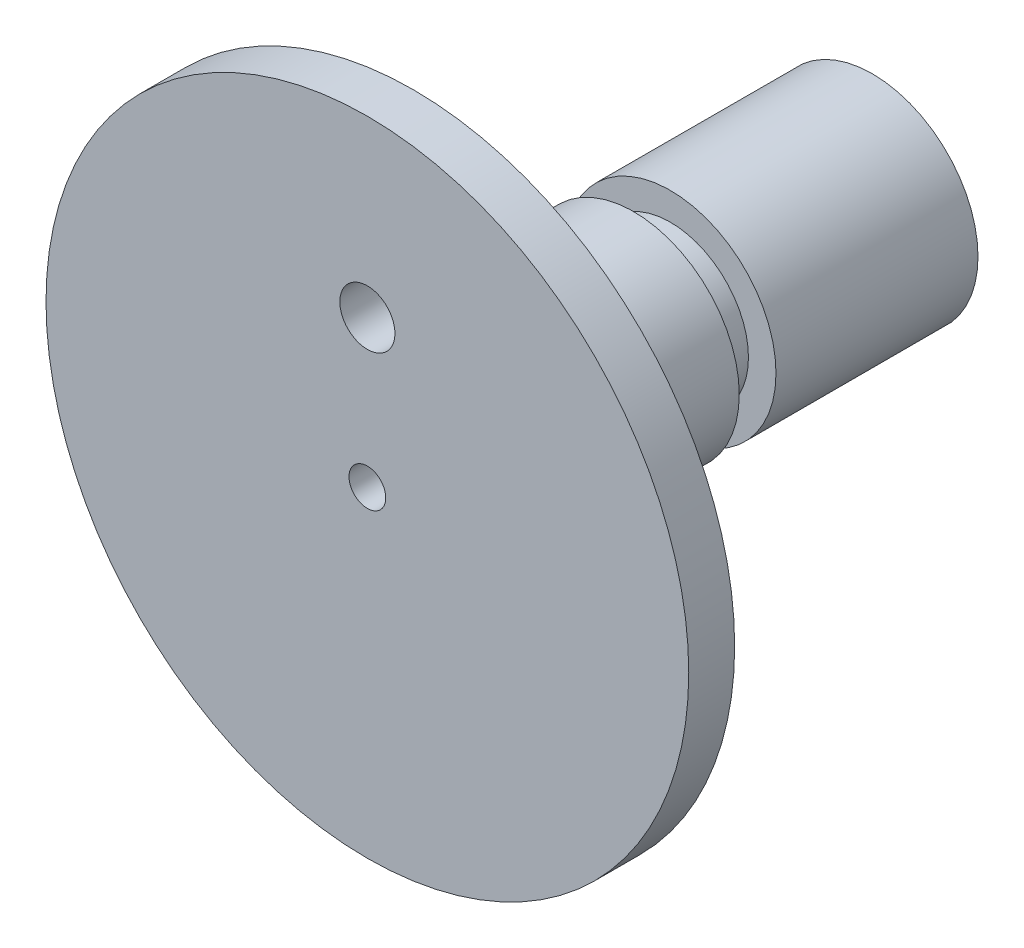
from build123d import *

# Parameters (mm, degrees)
CROQUIS2_R                  = 17.5
SALIENTE_EXTRUIR1_DEPTH     = 1.25
CROQUIS3_R                  = 5.75
SALIENTE_EXTRUIR2_DEPTH     = 25
CROQUIS4_R                  = 1
CORTAR_EXTRUIR1_DEPTH       = 15
CROQUIS7_R                  = 1.5
CORTAR_EXTRUIR2_DEPTH       = 10
CROQUIS8_W                  = 1.5
CROQUIS8_H                  = 2
CROQUIS8_W_2                = 1
REVOLUCI_N1_ANGLE           = 235
REVOLUCI_N1_OTHER_WAY_ANGLE = 57


with BuildPart() as part:
    # Croquis2 → Saliente-Extruir1 (new, symmetric)
    with BuildSketch(Plane.XY):
        Circle(CROQUIS2_R)
    extrude(amount=SALIENTE_EXTRUIR1_DEPTH, both=True)

    # Croquis3 → Saliente-Extruir2 (add)
    with BuildSketch(Plane(origin=(0, 0, -1.25), x_dir=(-1, 0, 0), z_dir=(0, 0, -1))):
        Circle(CROQUIS3_R)
        with BuildLine():
            ThreePointArc((1.95, -1.939071943), (0, -2.75), (-1.95, -1.939071943))
            Line((-1.95, -1.939071943), (-1.95, 1.939071943))
            ThreePointArc((-1.95, 1.939071943), (0, 2.75), (1.95, 1.939071943))
            Line((1.95, 1.939071943), (1.95, -1.939071943))
        make_face(mode=Mode.SUBTRACT)
    extrude(amount=SALIENTE_EXTRUIR2_DEPTH)

    # Croquis4 → Cortar-Extruir1 (cut)
    with BuildSketch(Plane.XY.offset(1.25)):
        Circle(CROQUIS4_R)
    extrude(amount=-CORTAR_EXTRUIR1_DEPTH, mode=Mode.SUBTRACT)

    # Croquis7 → Cortar-Extruir2 (cut)
    with BuildSketch(Plane.XY.offset(1.25)):
        with Locations((0, 8)):
            Circle(CROQUIS7_R)
    extrude(amount=-CORTAR_EXTRUIR2_DEPTH, mode=Mode.SUBTRACT)

    # Croquis8 → Cortar-Revolución1 (revolve, cut)
    with BuildSketch(Plane(origin=(0, 0, 0), x_dir=(1, 0, 0), z_dir=(0, 1, 0))):
        with Locations((5, 14.25)):
            Rectangle(CROQUIS8_W, CROQUIS8_H)
        with Locations((5.25, 8.25)):
            Rectangle(CROQUIS8_W_2, CROQUIS8_H)
    revolve(axis=Axis((0, 0, 0), (0, 0, -1)), mode=Mode.SUBTRACT)

    # Croquis10 → Revolución1 (revolve)
    with BuildSketch(Plane(origin=(0, 0, 0), x_dir=(1, 0, 0), z_dir=(0, 1, 0))):
        Polygon((-5.75, 3.75), (-8.75, 1.25), (-5.75, 1.25), align=None)
    revolve(axis=Axis((0, 0, -2.441145516), (0, 0, 1)), revolution_arc=REVOLUCI_N1_ANGLE)

    # Croquis10 → Revolución1 other way (revolve)
    with BuildSketch(Plane(origin=(0, 0, 0), x_dir=(1, 0, 0), z_dir=(0, 1, 0))):
        Polygon((-5.75, 3.75), (-8.75, 1.25), (-5.75, 1.25), align=None)
    revolve(axis=Axis((0, 0, -2.441145516), (0, 0, -1)), revolution_arc=REVOLUCI_N1_OTHER_WAY_ANGLE)


solid = part.part
